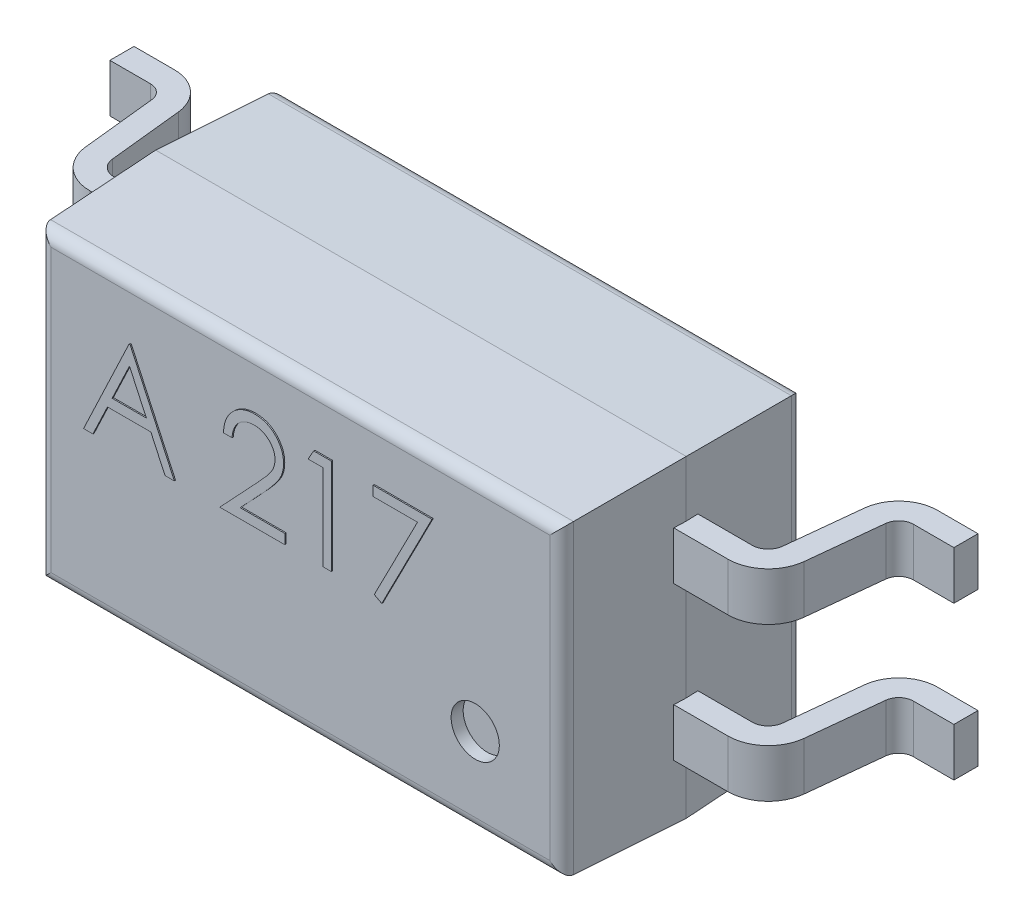
from build123d import *
from OCP.BRepFilletAPI import BRepFilletAPI_MakeChamfer

# Parameters (mm, degrees)
ESQUISSE1_W             = 4.4
ESQUISSE1_H             = 2.6
BOSS_EXTRU_1_DEPTH      = 2
CHANFREIN1_SIZE         = 1
CHANFREIN1_SIZE2        = 0.034921
CHANFREIN2_SIZE         = 0.034921
CHANFREIN2_SIZE_2       = 1
ESQUISSE2_R             = 0.2
ENL_V_MAT_EXTRU_1_DEPTH = 0.1
ESQUISSE3_W             = 0.3
ESQUISSE3_H             = 0.3
ENL_V_MAT_EXTRU_2_DEPTH = 6.488169
BOSS_EXTRU_2_DEPTH      = 0.000834
BOSS_EXTRU_2_DEPTH_BACK = 4.399166
ESQUISSE4_W             = 0.2
ESQUISSE4_H             = 0.4
ESQUISSE5_W             = 1.22
ESQUISSE5_H             = 0.4
BOSS_EXTRU_3_DEPTH      = 1.3
BOSS_EXTRU_4_OUTLINE_W  = 1.22
BOSS_EXTRU_4_OUTLINE_H  = 0.4
BOSS_EXTRU_4_DEPTH      = 1.3
ENL_V_MAT_EXTRU_3_DEPTH = 7.406889
CONG_1_R                = 0.1
CONG_2_R                = 0.1
BOSS_EXTRU_5_DEPTH      = 0.01


with BuildPart() as part:
    # Esquisse1 → Boss.-Extru.1 (new body)
    with BuildSketch(Plane.XY):
        with Locations((2.2, 1.3)):
            Rectangle(ESQUISSE1_W, ESQUISSE1_H)
    extrude(amount=BOSS_EXTRU_1_DEPTH)

    # Chanfrein1: one chamfer whose edges measure the first distance from different faces: ONE call of the kernel's chamfer builder (chamfer() names one face for all edges)
    chanfrein1_edges_1 = [part.edges().sort_by_distance(p)[0] for p in [
        (0, 1.3, 2),
    ]]
    chanfrein1_side_1 = [part.faces().sort_by_distance(p)[0] for p in [
        (0, 1.3, 1),
    ]]
    chanfrein1_edges_2 = [part.edges().sort_by_distance(p)[0] for p in [
        (2.2, 0, 2),
    ]]
    chanfrein1_side_2 = [part.faces().sort_by_distance(p)[0] for p in [
        (2.2, 0, 1),
    ]]
    chanfrein1_edges_3 = [part.edges().sort_by_distance(p)[0] for p in [
        (4.4, 1.3, 2),
    ]]
    chanfrein1_side_3 = [part.faces().sort_by_distance(p)[0] for p in [
        (4.4, 1.3, 1),
    ]]
    chanfrein1_edges_4 = [part.edges().sort_by_distance(p)[0] for p in [
        (2.2, 2.6, 2),
    ]]
    chanfrein1_side_4 = [part.faces().sort_by_distance(p)[0] for p in [
        (2.2, 2.6, 1),
    ]]
    chanfrein1 = BRepFilletAPI_MakeChamfer(part.part.solid().wrapped)
    for e in chanfrein1_edges_1:
        chanfrein1.Add(CHANFREIN1_SIZE, CHANFREIN1_SIZE2, e.wrapped, chanfrein1_side_1[0].wrapped)  # the first distance lies on this face
    for e in chanfrein1_edges_2:
        chanfrein1.Add(CHANFREIN1_SIZE, CHANFREIN1_SIZE2, e.wrapped, chanfrein1_side_2[0].wrapped)  # the first distance lies on this face
    for e in chanfrein1_edges_3:
        chanfrein1.Add(CHANFREIN1_SIZE, CHANFREIN1_SIZE2, e.wrapped, chanfrein1_side_3[0].wrapped)  # the first distance lies on this face
    for e in chanfrein1_edges_4:
        chanfrein1.Add(CHANFREIN1_SIZE, CHANFREIN1_SIZE2, e.wrapped, chanfrein1_side_4[0].wrapped)  # the first distance lies on this face
    add(Compound.cast(chanfrein1.Shape()), mode=Mode.REPLACE)

    # Chanfrein2
    chanfrein2_edges_1 = [part.edges().sort_by_distance(p)[0] for p in [
        (2.2, 0, 0),
    ]]
    chanfrein2_side_1 = [part.faces().sort_by_distance(p)[0] for p in [
        (2.2, 0.000698, 0),
    ]]
    chanfrein2_edges_2 = [part.edges().sort_by_distance(p)[0] for p in [
        (4.4, 1.3, 0),
    ]]
    chanfrein2_side_2 = [part.faces().sort_by_distance(p)[0] for p in [
        (4.4, 1.3, 0.000698),
    ]]
    chanfrein2_edges_3 = [part.edges().sort_by_distance(p)[0] for p in [
        (2.2, 2.6, 0),
    ]]
    chanfrein2_side_3 = [part.faces().sort_by_distance(p)[0] for p in [
        (2.2, 2.6, 0.000698),
    ]]
    chanfrein2_edges_4 = [part.edges().sort_by_distance(p)[0] for p in [
        (0, 1.3, 0),
    ]]
    chanfrein2_side_4 = [part.faces().sort_by_distance(p)[0] for p in [
        (0.000698, 1.3, 0),
    ]]
    chanfrein2 = BRepFilletAPI_MakeChamfer(part.part.solid().wrapped)
    for e in chanfrein2_edges_1:
        chanfrein2.Add(CHANFREIN2_SIZE - 0.0001, CHANFREIN2_SIZE_2 - 0.0001, e.wrapped, chanfrein2_side_1[0].wrapped)
    for e in chanfrein2_edges_2:
        chanfrein2.Add(CHANFREIN2_SIZE_2 - 0.0001, CHANFREIN2_SIZE - 0.0001, e.wrapped, chanfrein2_side_2[0].wrapped)
    for e in chanfrein2_edges_3:
        chanfrein2.Add(CHANFREIN2_SIZE_2 - 0.0001, CHANFREIN2_SIZE - 0.0001, e.wrapped, chanfrein2_side_3[0].wrapped)
    for e in chanfrein2_edges_4:
        chanfrein2.Add(CHANFREIN2_SIZE - 0.0001, CHANFREIN2_SIZE_2 - 0.0001, e.wrapped, chanfrein2_side_4[0].wrapped)
    add(Compound.cast(chanfrein2.Shape()), mode=Mode.REPLACE)  # a hair under: the kernel refuses the full size

    # Esquisse2 → Enlèv. mat.-Extru.1 (cut)
    with BuildSketch(Plane.XY.offset(2)):
        with Locations((3.65, 0.75)):
            Circle(ESQUISSE2_R)
    extrude(amount=-ENL_V_MAT_EXTRU_1_DEPTH, mode=Mode.SUBTRACT)

    # Esquisse3 → Enlèv. mat.-Extru.2 (cut, through all)
    with BuildSketch(Plane.XY.offset(2)):
        with Locations((4.549166, 1.921549)):
            Rectangle(ESQUISSE3_W, ESQUISSE3_H)
        with Locations((-0.149629, 1.921549)):
            Rectangle(ESQUISSE3_W, ESQUISSE3_H)
    extrude(amount=-ENL_V_MAT_EXTRU_2_DEPTH, mode=Mode.SUBTRACT)

    # Esquisse4 → Boss.-Extru.2 (add, two sides: drawn at the far end of the back side and taken through both)
    with BuildSketch(Plane(origin=(4.399166, 0, 0), x_dir=(0, 0, -1), z_dir=(1, 0, 0)).offset(-BOSS_EXTRU_2_DEPTH_BACK)):
        Polygon((-1.1, 2.135), (-1, 2.135), (-0.9, 2.135), (-0.9, 1.735), (-1.1, 1.735), align=None)
        with Locations((-1, 0.665)):
            Rectangle(ESQUISSE4_W, ESQUISSE4_H)
    extrude(amount=BOSS_EXTRU_2_DEPTH + BOSS_EXTRU_2_DEPTH_BACK)

    # Esquisse5 → Boss.-Extru.3 (add)
    with BuildSketch(Plane.ZY):
        with Locations((0.49, 0.665)):
            Rectangle(ESQUISSE5_W, ESQUISSE5_H)
        with Locations((0.49, 1.935)):
            Rectangle(ESQUISSE5_W, ESQUISSE5_H)
    extrude(amount=BOSS_EXTRU_3_DEPTH)

    # Boss.-Extru.4: read off the stored shape, not the designer's step
    # Boss.-Extru.4 outline → Boss.-Extru.4 (add)
    with BuildSketch(Plane(origin=(4.4, 0, 0), x_dir=(0, 0, -1), z_dir=(1, 0, 0))):
        with Locations((-0.49, 1.935)):
            Rectangle(BOSS_EXTRU_4_OUTLINE_W, BOSS_EXTRU_4_OUTLINE_H)
        with Locations((-0.49, 0.665)):
            Rectangle(BOSS_EXTRU_4_OUTLINE_W, BOSS_EXTRU_4_OUTLINE_H)
    extrude(amount=BOSS_EXTRU_4_DEPTH)

    # Esquisse7 → Enlèv. mat.-Extru.3 (cut, through all)
    with BuildSketch(Plane.XZ.offset(-0.465)):
        with BuildLine():
            Line((0, 0.9), (-0.446508, 0.9))
            ThreePointArc((-0.446508, 0.9), (-0.536245, 0.865574), (-0.579932, 0.779961))
            Line((-0.579932, 0.779961), (-0.644812, 0.167386))
            ThreePointArc((-0.644812, 0.167386), (-0.749402, -0.037579), (-0.964243, -0.12))
            Line((-0.964243, -0.12), (0, -0.12))
            Line((0, -0.12), (0, 0.9))
        make_face()
        with BuildLine():
            Line((-1.3, 0.08), (-0.964243, 0.08))
            ThreePointArc((-0.964243, 0.08), (-0.883169, 0.111103), (-0.843699, 0.188451))
            Line((-0.843699, 0.188451), (-0.778819, 0.801026))
            ThreePointArc((-0.778819, 0.801026), (-0.670012, 1.014256), (-0.446508, 1.1))
            Line((-0.446508, 1.1), (-1.3, 1.1))
            Line((-1.3, 1.1), (-1.3, 0.08))
        make_face()
        with BuildLine():
            Line((4.4, -0.12), (5.364243, -0.12))
            ThreePointArc((5.364243, -0.12), (5.149402, -0.037579), (5.044812, 0.167386))
            Line((5.044812, 0.167386), (4.979932, 0.779961))
            ThreePointArc((4.979932, 0.779961), (4.936245, 0.865574), (4.846508, 0.9))
            Line((4.846508, 0.9), (4.4, 0.9))
            Line((4.4, 0.9), (4.4, -0.12))
        make_face()
        with BuildLine():
            Line((5.7, 1.1), (4.846508, 1.1))
            ThreePointArc((4.846508, 1.1), (5.070012, 1.014256), (5.178819, 0.801026))
            Line((5.178819, 0.801026), (5.243699, 0.188451))
            ThreePointArc((5.243699, 0.188451), (5.283169, 0.111103), (5.364243, 0.08))
            Line((5.364243, 0.08), (5.7, 0.08))
            Line((5.7, 0.08), (5.7, 1.1))
        make_face()
    extrude(amount=-ENL_V_MAT_EXTRU_3_DEPTH, mode=Mode.SUBTRACT)

    # Congé1
    cong_1_edges = [part.edges().sort_by_distance(p)[0] for p in [
        (2.2, 2.565079, 2),
        (4.365079, 1.3, 2),
        (0.034921, 1.3, 2),
        (2.2, 0.034921, 2),
    ]]
    fillet(cong_1_edges, radius=CONG_1_R)

    # Congé2
    cong_2_edges = [part.edges().sort_by_distance(p)[0] for p in [
        (0.034821, 1.3, 0),
        (2.2, 2.565179, 0),
        (4.365179, 1.3, 0),
        (2.2, 0.034821, 0),
    ]]
    fillet(cong_2_edges, radius=CONG_2_R)

    # Esquisse8 → Boss.-Extru.5 (add)
    # profile 1 of 4: a face of its own
    with BuildSketch(Plane.XY.offset(2)):
        Polygon((0.7984, 2.104783), (1.164747, 1.311033), (1.087311, 1.311033), (0.969966, 1.56544), (0.610139, 1.56544), (0.489455, 1.311033), (0.411702, 1.311033), (0.788224, 2.104783), align=None)
        Polygon((0.792517, 1.950072), (0.648777, 1.64685), (0.932441, 1.64685), align=None, mode=Mode.SUBTRACT)
    # profile 2 of 4: a face of its own
    with BuildSketch(Plane.XY.offset(2)):
        with BuildLine():
            Line((1.643032, 1.860552), (1.571798, 1.860552))
            add(Edge.make_bspline(
                [(1.571798, 1.860552), (1.572262, 1.870003), (1.573174, 1.888563), (1.577444, 1.915624), (1.583554, 1.94149), (1.592192, 1.965953), (1.602921, 1.98923), (1.615786, 2.011229), (1.631025, 2.031864), (1.648307, 2.050946), (1.667078, 2.068451), (1.687332, 2.083567), (1.708614, 2.096339), (1.730862, 2.107016), (1.754325, 2.115031), (1.778791, 2.120978), (1.804368, 2.124556), (1.821794, 2.12494), (1.830657, 2.125136)],
                knots=[0, 0, 0, 0, 1.100653, 2.161653, 3.183659, 4.190469, 5.17592, 6.163126, 7.151508, 8.156236, 9.156009, 10.134483, 11.092019, 12.041331, 13.001268, 13.972401, 14.968799, 16, 16, 16, 16], degree=3))
            add(Edge.make_bspline(
                [(1.830657, 2.125136), (1.839361, 2.124932), (1.856463, 2.124532), (1.881423, 2.121093), (1.905185, 2.115708), (1.927702, 2.108153), (1.948795, 2.097996), (1.968621, 2.085796), (1.987417, 2.071685), (2.004337, 2.055072), (2.019874, 2.037337), (2.033277, 2.018403), (2.044756, 1.998848), (2.054323, 1.978521), (2.061366, 1.957233), (2.066714, 1.935292), (2.069736, 1.912471), (2.0702, 1.897026), (2.070436, 1.889173)],
                knots=[0, 0, 0, 0, 1.111607, 2.184269, 3.212621, 4.221275, 5.21176, 6.196651, 7.192148, 8.207485, 9.220403, 10.201282, 11.166442, 12.114753, 13.065576, 14.026451, 14.996634, 16, 16, 16, 16], degree=3))
            add(Edge.make_bspline(
                [(2.070436, 1.889173), (2.070052, 1.878118), (2.06929, 1.856201), (2.062778, 1.823994), (2.052608, 1.79279), (2.040362, 1.767676), (2.028008, 1.74744), (2.016876, 1.730778), (2.003844, 1.712838), (1.988722, 1.69368), (1.971824, 1.673153), (1.952995, 1.651271), (1.932103, 1.628258), (1.91744, 1.612541), (1.909841, 1.604396)],
                knots=[0, 0, 0, 0, 1.184426, 2.348068, 3.509069, 4.696111, 5.333549, 6.050745, 6.844228, 7.710549, 8.66745, 9.695053, 10.805634, 12, 12, 12, 12], degree=3))
            Line((1.909841, 1.604396), (1.711245, 1.392443))
            Line((1.711245, 1.392443), (2.080612, 1.392443))
            Line((2.080612, 1.392443), (2.080612, 1.311033))
            Line((2.080612, 1.311033), (1.541269, 1.311033))
            Line((1.541269, 1.311033), (1.849102, 1.639536))
            add(Edge.make_bspline(
                [(1.849102, 1.639536), (1.856596, 1.64736), (1.870992, 1.662388), (1.891354, 1.684328), (1.909641, 1.704682), (1.925974, 1.723411), (1.939997, 1.74079), (1.952441, 1.756256), (1.962412, 1.770487), (1.973233, 1.786984), (1.983714, 1.807125), (1.99272, 1.831739), (1.998212, 1.857077), (1.99887, 1.8742), (1.999202, 1.882813)],
                knots=[0, 0, 0, 0, 1.329632, 2.55395, 3.673216, 4.687768, 5.603094, 6.413772, 7.123043, 7.734684, 8.834405, 9.900288, 10.943827, 12, 12, 12, 12], degree=3))
            add(Edge.make_bspline(
                [(1.999202, 1.882813), (1.999058, 1.888229), (1.998773, 1.898903), (1.996266, 1.914552), (1.992476, 1.929648), (1.987046, 1.944237), (1.979878, 1.958172), (1.971152, 1.97147), (1.961085, 1.984326), (1.94944, 1.996381), (1.936646, 2.007421), (1.923131, 2.017201), (1.908832, 2.025374), (1.89381, 2.032074), (1.878106, 2.03733), (1.86169, 2.040972), (1.844608, 2.043258), (1.832943, 2.043568), (1.827, 2.043725)],
                knots=[0, 0, 0, 0, 0.991446, 1.95395, 2.895816, 3.838931, 4.798493, 5.759822, 6.748412, 7.785213, 8.824557, 9.840281, 10.836138, 11.835679, 12.848802, 13.863922, 14.911576, 16, 16, 16, 16], degree=3))
            add(Edge.make_bspline(
                [(1.827, 2.043725), (1.820793, 2.043563), (1.808602, 2.043245), (1.790705, 2.041017), (1.773631, 2.037174), (1.757338, 2.031918), (1.741799, 2.025237), (1.727089, 2.016916), (1.713241, 2.006987), (1.700228, 1.995729), (1.68824, 1.983195), (1.677706, 1.969223), (1.668502, 1.954067), (1.660472, 1.937769), (1.653951, 1.920181), (1.648967, 1.901365), (1.645024, 1.881403), (1.643707, 1.867618), (1.643032, 1.860552)],
                knots=[0, 0, 0, 0, 1.031019, 2.024751, 2.990194, 3.934041, 4.864654, 5.795059, 6.735615, 7.690565, 8.649604, 9.611026, 10.590973, 11.59108, 12.624614, 13.70102, 14.821632, 16, 16, 16, 16], degree=3))
        make_face()
    # profile 3 of 4: a face of its own
    with BuildSketch(Plane.XY.offset(2)):
        Polygon((2.32055, 2.104783), (2.467311, 2.104783), (2.467311, 1.311033), (2.396077, 1.311033), (2.396077, 2.023373), (2.273961, 2.023373), align=None)
    # profile 4 of 4: a face of its own
    with BuildSketch(Plane.XY.offset(2)):
        Polygon((2.813304, 2.104783), (3.301766, 2.104783), (2.884538, 1.290681), (2.823004, 1.324549), (3.18124, 2.023373), (2.813304, 2.023373), align=None)
    extrude(amount=BOSS_EXTRU_5_DEPTH)


solid = part.part
